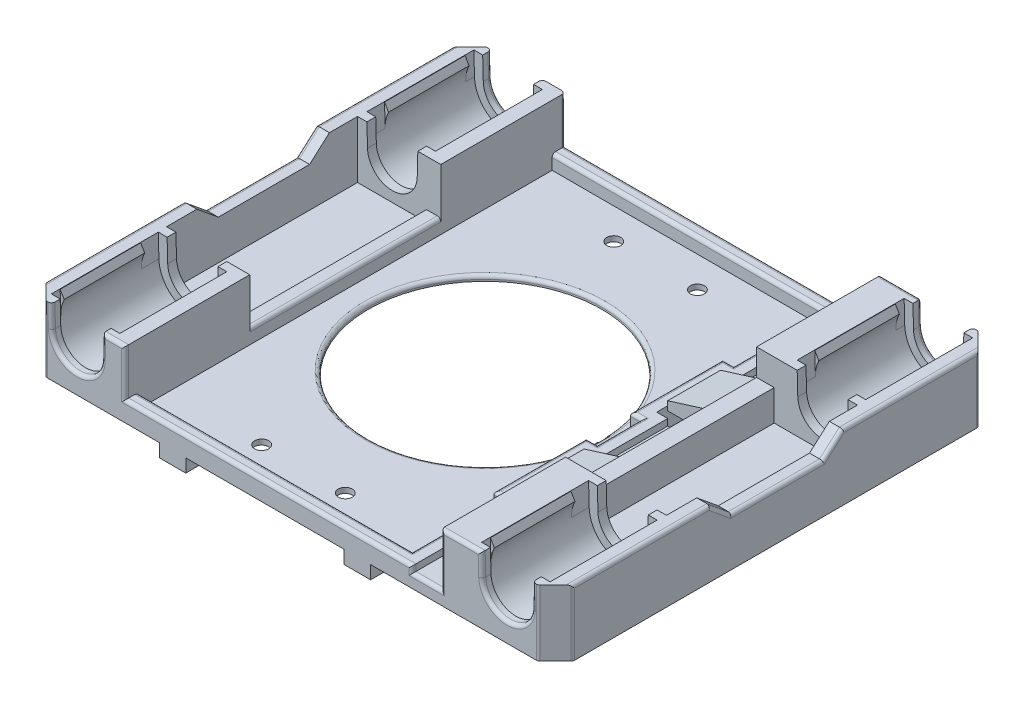
from build123d import *

# Parameters (mm, degrees)
SKETCH1_W               = 124.76
SKETCH1_H               = 100
BOSS_EXTRUDE1_DEPTH     = 20
SKETCH2_R               = 7.65
CUT_EXTRUDE1_DEPTH      = 120.546076473
SKETCH4_W               = 96
SKETCH4_H               = 18
CUT_EXTRUDE2_DEPTH      = 21.26
SKETCH5_W               = 96
SKETCH5_H               = 18
CUT_EXTRUDE3_DEPTH      = 24.5
SKETCH6_W               = 22
SKETCH6_H               = 18
SKETCH6_R               = 7.65
BOSS_EXTRUDE2_DEPTH     = 24.3
MIRROR2_COPY_1_SKETCH_W = 22
MIRROR2_COPY_1_SKETCH_H = 18
MIRROR2_COPY_1_SKETCH_R = 7.65
MIRROR2_COPY_1_DEPTH    = 24.3
CUT_EXTRUDE4_DEPTH      = 4
MIRROR4_COPY_1_DEPTH    = 4
CUT_EXTRUDE5_DEPTH      = 4
MIRROR6_COPY_1_DEPTH    = 4
CUT_EXTRUDE6_DEPTH      = 117.220757182
BOSS_EXTRUDE3_DEPTH     = 2
MIRROR11_COPY_1_DEPTH   = 2
BOSS_EXTRUDE4_DEPTH     = 2
MIRROR13_COPY_1_DEPTH   = 2
SKETCH14_W              = 2.5
SKETCH14_H              = 100
CUT_EXTRUDE9_DEPTH      = 83.421833499
SKETCH15_W              = 6.5
SKETCH15_H              = 100
CUT_EXTRUDE10_DEPTH     = 17
SKETCH16_W              = 3.08585698
SKETCH16_H              = 43.4
BOSS_EXTRUDE6_DEPTH     = 18
CUT_EXTRUDE11_DEPTH     = 16
SKETCH18_W              = 9
SKETCH18_H              = 15
CUT_EXTRUDE12_DEPTH     = 25
SKETCH19_W              = 12
SKETCH19_H              = 2
BOSS_EXTRUDE7_DEPTH     = 8
SKETCH21_R              = 26.5
CUT_EXTRUDE13_DEPTH     = 81.533312362
SKETCH23_W              = 119.76
SKETCH23_H              = 5.5
CUT_EXTRUDE18_DEPTH     = 119.269643769
SKETCH26_W              = 65.265
SKETCH26_H              = 100
CUT_EXTRUDE19_DEPTH     = 6.02
SKETCH27_W              = 43.4
SKETCH27_H              = 6.02
CUT_EXTRUDE20_DEPTH     = 6
SKETCH28_W              = 43.4
SKETCH28_H              = 6.02
CUT_EXTRUDE21_DEPTH     = 6
CUT_EXTRUDE25_DEPTH     = 4.48
SKETCH29_R              = 26.5
CUT_EXTRUDE23_DEPTH     = 3.3
CUT_EXTRUDE24_DEPTH     = 80.439375627
MIRROR21_COPY_1_DEPTH   = 80.439375627
FILLET3_R               = 0.8
RIB1_REACH              = 113.371
SKETCH32_WALL_W         = 233.117026496
SKETCH32_WALL_H         = 12
BOSS_EXTRUDE8_DEPTH     = 8
LPATTERN1_COUNT         = 3
LPATTERN1_PITCH         = 2
LPATTERN1_COL_COUNT     = 3
LPATTERN1_COL_PITCH     = 2
MIRROR23_COPY_1_DEPTH   = 8
MIRROR23_COPY_2_DEPTH   = 8
MIRROR23_COPY_3_DEPTH   = 8
MIRROR23_COPY_4_DEPTH   = 8
SKETCH37_W              = 6
SKETCH37_H              = 6
BOSS_EXTRUDE9_DEPTH     = 3
SKETCH38_W              = 5
SKETCH38_H              = 15
SKETCH38_W_2            = 4.5
SKETCH38_H_2            = 21
BOSS_EXTRUDE10_DEPTH    = 3
CUT_EXTRUDE26_REACH     = 81.439
SKETCH39_R              = 1.6


with BuildPart() as part:
    # Sketch1 → Boss-Extrude1 (new body)
    with BuildSketch(Plane(origin=(0, 0, 0), x_dir=(1, 0, 0), z_dir=(0, 1, 0))):
        Rectangle(SKETCH1_W, SKETCH1_H)
    extrude(amount=BOSS_EXTRUDE1_DEPTH)

    # Sketch2 → Cut-Extrude1 (cut, through all)
    with BuildSketch(Plane.XY.offset(50)):
        with Locations((-48.88, 10)):
            Circle(SKETCH2_R)
        with Locations((48.88, 10)):
            Circle(SKETCH2_R)
    extrude(amount=-CUT_EXTRUDE1_DEPTH, mode=Mode.SUBTRACT)

    # Sketch4 → Cut-Extrude2 (cut)
    with BuildSketch(Plane.ZY.offset(62.38)):
        with Locations((0, 11)):
            Rectangle(SKETCH4_W, SKETCH4_H)
    extrude(amount=-CUT_EXTRUDE2_DEPTH, mode=Mode.SUBTRACT)

    # Sketch5 → Cut-Extrude3 (cut)
    with BuildSketch(Plane(origin=(62.38, 0, 0), x_dir=(0, 0, -1), z_dir=(1, 0, 0))):
        with Locations((0, 11)):
            Rectangle(SKETCH5_W, SKETCH5_H)
    extrude(amount=-CUT_EXTRUDE3_DEPTH, mode=Mode.SUBTRACT)

    # Sketch6 → Boss-Extrude2 (add)
    with BuildSketch(Plane(origin=(0, 0, 48), x_dir=(-1, 0, 0), z_dir=(0, 0, -1))):
        with Locations((48.88, 11)):
            Rectangle(SKETCH6_W, SKETCH6_H)
        with Locations(Location((48.88, 10, 0), (0, 0, 180))):
            Circle(SKETCH6_R, mode=Mode.SUBTRACT)
    boss_extrude2 = extrude(amount=BOSS_EXTRUDE2_DEPTH)

    # Mirror1: Boss-Extrude2 across plane
    add(boss_extrude2.mirror(Plane.XY))

    # Mirror2: Boss-Extrude2 across plane
    add(boss_extrude2.mirror(Plane(origin=(0, 0, 0), x_dir=(0, 0, 1), z_dir=(1, 0, 0))))

    # Mirror2 copy 1 sketch → Mirror2 copy 1 (add)
    with BuildSketch(Plane.XY.offset(-48)):
        with Locations((48.88, 11)):
            Rectangle(MIRROR2_COPY_1_SKETCH_W, MIRROR2_COPY_1_SKETCH_H)
        with Locations(Location((48.88, 10, 0), (0, 0, 180))):
            Circle(MIRROR2_COPY_1_SKETCH_R, mode=Mode.SUBTRACT)
    extrude(amount=MIRROR2_COPY_1_DEPTH)

    # Sketch7 → Cut-Extrude4 (cut)
    with BuildSketch(Plane.XY.offset(50)):
        with BuildLine():
            Line((41.232614826, 9.8), (40.96585698, 20))
            Line((40.96585698, 20), (56.79414302, 20))
            Line((56.79414302, 20), (56.527385174, 9.8))
            ThreePointArc((56.527385174, 9.8), (48.88, 2.35), (41.232614826, 9.8))
        make_face()
    cut_extrude4 = extrude(amount=-CUT_EXTRUDE4_DEPTH, mode=Mode.SUBTRACT)

    # Mirror3: Cut-Extrude4 across plane
    add(cut_extrude4.mirror(Plane(origin=(0, 0, 0), x_dir=(0, 0, 1), z_dir=(1, 0, 0))), mode=Mode.SUBTRACT)

    # Mirror4: Cut-Extrude4 across plane
    add(cut_extrude4.mirror(Plane.XY), mode=Mode.SUBTRACT)

    # Mirror4 copy 1 sketch → Mirror4 copy 1 (cut)
    with BuildSketch(Plane(origin=(0, 0, -50), x_dir=(-1, 0, 0), z_dir=(0, 0, -1))):
        with BuildLine():
            Line((41.232614826, 9.8), (40.96585698, 20))
            Line((40.96585698, 20), (56.79414302, 20))
            Line((56.79414302, 20), (56.527385174, 9.8))
            ThreePointArc((56.527385174, 9.8), (48.88, 2.35), (41.232614826, 9.8))
        make_face()
    extrude(amount=-MIRROR4_COPY_1_DEPTH, mode=Mode.SUBTRACT)

    # Sketch8 → Cut-Extrude5 (cut)
    with BuildSketch(Plane.XY.offset(-23.7)):
        with BuildLine():
            Line((56.527385174, 9.8), (56.79414302, 20))
            Line((56.79414302, 20), (40.96585698, 20))
            Line((40.96585698, 20), (41.232614826, 9.8))
            ThreePointArc((41.232614826, 9.8), (48.88, 2.35), (56.527385174, 9.8))
        make_face()
    cut_extrude5 = extrude(amount=-CUT_EXTRUDE5_DEPTH, mode=Mode.SUBTRACT)

    # Mirror5: Cut-Extrude5 across plane
    add(cut_extrude5.mirror(Plane(origin=(0, 0, 0), x_dir=(0, 0, 1), z_dir=(1, 0, 0))), mode=Mode.SUBTRACT)

    # Mirror6: Cut-Extrude5 across plane
    add(cut_extrude5.mirror(Plane.XY), mode=Mode.SUBTRACT)

    # Mirror6 copy 1 sketch → Mirror6 copy 1 (cut)
    with BuildSketch(Plane(origin=(0, 0, 23.7), x_dir=(-1, 0, 0), z_dir=(0, 0, -1))):
        with BuildLine():
            Line((56.527385174, 9.8), (56.79414302, 20))
            Line((56.79414302, 20), (40.96585698, 20))
            Line((40.96585698, 20), (41.232614826, 9.8))
            ThreePointArc((41.232614826, 9.8), (48.88, 2.35), (56.527385174, 9.8))
        make_face()
    extrude(amount=-MIRROR6_COPY_1_DEPTH, mode=Mode.SUBTRACT)

    # Sketch10 → Cut-Extrude6 (cut, symmetric)
    with BuildSketch(Plane(origin=(0, 0, -46), x_dir=(-1, 0, 0), z_dir=(0, 0, -1))):
        with BuildLine():
            Line((41.09916923, 14.902549345), (41.999314668, 13.343451713))
            ThreePointArc((41.999314668, 13.343451713), (48.88, 17.65), (55.760685332, 13.343451713))
            Line((55.760685332, 13.343451713), (56.66083077, 14.902549345))
            Line((56.66083077, 14.902549345), (56.79414302, 20))
            Line((56.79414302, 20), (40.96585698, 20))
            Line((40.96585698, 20), (41.09916923, 14.902549345))
        make_face()
    cut_extrude6 = extrude(amount=CUT_EXTRUDE6_DEPTH, both=True, mode=Mode.SUBTRACT)

    # Mirror7: Cut-Extrude6 across plane
    add(cut_extrude6.mirror(Plane(origin=(0, 0, 0), x_dir=(0, 0, 1), z_dir=(1, 0, 0))), mode=Mode.SUBTRACT)

    # Sketch12 → Boss-Extrude3 (add)
    with BuildSketch(Plane(origin=(0, 0, -50), x_dir=(-1, 0, 0), z_dir=(0, 0, -1))):
        with BuildLine():
            Line((54.794826635, 20.052287582), (62.38, 20))
            Line((62.38, 20), (62.38, 0))
            Line((62.38, 0), (30.802582176, 0))
            Line((30.802582176, 0), (30.802582176, 20))
            Line((30.802582176, 20), (42.965173365, 20.052287582))
            Line((42.965173365, 20.052287582), (43.231931211, 9.852287582))
            ThreePointArc((43.231931211, 9.852287582), (48.88, 4.35), (54.528068789, 9.852287582))
            Line((54.528068789, 9.852287582), (54.794826635, 20.052287582))
        make_face()
    boss_extrude3 = extrude(amount=-BOSS_EXTRUDE3_DEPTH)

    # Mirror10: Boss-Extrude3 across plane
    add(boss_extrude3.mirror(Plane(origin=(0, 0, 0), x_dir=(0, 0, 1), z_dir=(1, 0, 0))))

    # Mirror11: Boss-Extrude3 across plane
    add(boss_extrude3.mirror(Plane.XY))

    # Mirror11 copy 1 sketch → Mirror11 copy 1 (add)
    with BuildSketch(Plane.XY.offset(50)):
        with BuildLine():
            Line((54.794826635, 20.052287582), (62.38, 20))
            Line((62.38, 20), (62.38, 0))
            Line((62.38, 0), (30.802582176, 0))
            Line((30.802582176, 0), (30.802582176, 20))
            Line((30.802582176, 20), (42.965173365, 20.052287582))
            Line((42.965173365, 20.052287582), (43.231931211, 9.852287582))
            ThreePointArc((43.231931211, 9.852287582), (48.88, 4.35), (54.528068789, 9.852287582))
            Line((54.528068789, 9.852287582), (54.794826635, 20.052287582))
        make_face()
    extrude(amount=-MIRROR11_COPY_1_DEPTH)

    # Sketch13 → Boss-Extrude4 (add)
    with BuildSketch(Plane(origin=(0, 0, 23.7), x_dir=(-1, 0, 0), z_dir=(0, 0, -1))):
        with BuildLine():
            Line((54.794826635, 20.052287582), (54.528068789, 9.852287582))
            ThreePointArc((54.528068789, 9.852287582), (48.88, 4.35), (43.231931211, 9.852287582))
            Line((43.231931211, 9.852287582), (42.965173365, 20.052287582))
            Line((42.965173365, 20.052287582), (35.5, 20))
            Line((35.5, 20), (35.5, 2))
            Line((35.5, 2), (59.88, 2))
            Line((59.88, 2), (59.88, 20))
            Line((59.88, 20), (56.79414302, 20))
            Line((56.79414302, 20), (54.794826635, 20.052287582))
        make_face()
    boss_extrude4 = extrude(amount=BOSS_EXTRUDE4_DEPTH)

    # Mirror12: Boss-Extrude4 across plane
    add(boss_extrude4.mirror(Plane(origin=(0, 0, 0), x_dir=(0, 0, 1), z_dir=(1, 0, 0))))

    # Mirror13: Boss-Extrude4 across plane
    add(boss_extrude4.mirror(Plane.XY))

    # Mirror13 copy 1 sketch → Mirror13 copy 1 (add)
    with BuildSketch(Plane.XY.offset(-23.7)):
        with BuildLine():
            Line((54.794826635, 20.052287582), (54.528068789, 9.852287582))
            ThreePointArc((54.528068789, 9.852287582), (48.88, 4.35), (43.231931211, 9.852287582))
            Line((43.231931211, 9.852287582), (42.965173365, 20.052287582))
            Line((42.965173365, 20.052287582), (35.5, 20))
            Line((35.5, 20), (35.5, 2))
            Line((35.5, 2), (59.88, 2))
            Line((59.88, 2), (59.88, 20))
            Line((59.88, 20), (56.79414302, 20))
            Line((56.79414302, 20), (54.794826635, 20.052287582))
        make_face()
    extrude(amount=MIRROR13_COPY_1_DEPTH)

    # Sketch14 → Cut-Extrude9 (cut, through all)
    with BuildSketch(Plane.XZ):
        with Locations((61.13, 0)):
            Rectangle(SKETCH14_W, SKETCH14_H)
    cut_extrude9 = extrude(amount=-CUT_EXTRUDE9_DEPTH, mode=Mode.SUBTRACT)

    # Mirror15: Cut-Extrude9 across plane
    add(cut_extrude9.mirror(Plane(origin=(0, 0, 0), x_dir=(0, 0, 1), z_dir=(1, 0, 0))), mode=Mode.SUBTRACT)

    # Sketch15 → Cut-Extrude10 (cut)
    with BuildSketch(Plane(origin=(0, 20, 0), x_dir=(1, 0, 0), z_dir=(0, 1, 0))):
        with Locations((30.63, 0)):
            Rectangle(SKETCH15_W, SKETCH15_H)
    extrude(amount=-CUT_EXTRUDE10_DEPTH, mode=Mode.SUBTRACT)

    # Sketch16 → Boss-Extrude6 (add)
    with BuildSketch(Plane(origin=(0, 2, 0), x_dir=(1, 0, 0), z_dir=(0, 1, 0))):
        with Locations((-58.33707151, 0)):
            Rectangle(SKETCH16_W, SKETCH16_H)
    boss_extrude6 = extrude(amount=BOSS_EXTRUDE6_DEPTH)

    # Mirror16: Boss-Extrude6 across plane
    add(boss_extrude6.mirror(Plane(origin=(0, 0, 0), x_dir=(0, 0, 1), z_dir=(1, 0, 0))))

    # Sketch17 → Cut-Extrude11 (cut)
    with BuildSketch(Plane(origin=(59.88, 0, 0), x_dir=(0, 0, -1), z_dir=(1, 0, 0))):
        Polygon((20.943323178, 20), (10.8, 11), (-9.939894563, 11), (-20.900937415, 20), align=None)
    cut_extrude11 = extrude(amount=-CUT_EXTRUDE11_DEPTH, mode=Mode.SUBTRACT)

    # Mirror17: Cut-Extrude11 across plane
    add(cut_extrude11.mirror(Plane(origin=(0, 0, 0), x_dir=(0, 0, 1), z_dir=(1, 0, 0))), mode=Mode.SUBTRACT)

    # Sketch18 → Cut-Extrude12 (cut)
    with BuildSketch(Plane.XZ):
        with Locations((29.38, 15.5)):
            Rectangle(SKETCH18_W, SKETCH18_H)
    cut_extrude12 = extrude(amount=-CUT_EXTRUDE12_DEPTH, mode=Mode.SUBTRACT)

    # Mirror18: Cut-Extrude12 across plane
    add(cut_extrude12.mirror(Plane.XY), mode=Mode.SUBTRACT)

    # Sketch19 → Boss-Extrude7 (add)
    with BuildSketch(Plane.ZY.offset(-33.88)):
        with Locations((-15.5, 5.5)):
            Rectangle(SKETCH19_W, SKETCH19_H)
    boss_extrude7 = extrude(amount=BOSS_EXTRUDE7_DEPTH)

    # Mirror19: Boss-Extrude7 across plane
    add(boss_extrude7.mirror(Plane.XY))

    # Sketch21 → Cut-Extrude13 (cut, through all)
    with BuildSketch(Plane(origin=(0, 20, 0), x_dir=(1, 0, 0), z_dir=(0, 1, 0))):
        with Locations(Location((-6.12, 0, 0), (0, 0, 270))):
            Circle(SKETCH21_R)
    extrude(amount=-CUT_EXTRUDE13_DEPTH, mode=Mode.SUBTRACT)

    # Sketch23 → Cut-Extrude18 (cut, through all)
    with BuildSketch(Plane.XY.offset(50)):
        with Locations((0, 17.75)):
            Rectangle(SKETCH23_W, SKETCH23_H)
    extrude(amount=-CUT_EXTRUDE18_DEPTH, mode=Mode.SUBTRACT)

    # Sketch26 → Cut-Extrude19 (cut)
    with BuildSketch(Plane(origin=(0, 15, 0), x_dir=(1, 0, 0), z_dir=(0, 1, 0))):
        with Locations((-5.2525, 0)):
            Rectangle(SKETCH26_W, SKETCH26_H)
    extrude(amount=-CUT_EXTRUDE19_DEPTH, mode=Mode.SUBTRACT)

    # Sketch27 → Cut-Extrude20 (cut)
    with BuildSketch(Plane(origin=(-37.885, 0, 0), x_dir=(0, 0, -1), z_dir=(1, 0, 0))):
        with Locations((0, 11.99)):
            Rectangle(SKETCH27_W, SKETCH27_H)
    extrude(amount=-CUT_EXTRUDE20_DEPTH, mode=Mode.SUBTRACT)

    # Sketch28 → Cut-Extrude21 (cut)
    with BuildSketch(Plane(origin=(37.88, 0, 0), x_dir=(0, 0, -1), z_dir=(1, 0, 0))):
        with Locations((0, 11.99)):
            Rectangle(SKETCH28_W, SKETCH28_H)
    extrude(amount=-CUT_EXTRUDE21_DEPTH, mode=Mode.SUBTRACT)

    # Sketch31 → Cut-Extrude25 (cut)
    with BuildSketch(Plane(origin=(0, 8.98, 0), x_dir=(1, 0, 0), z_dir=(0, 1, 0))):
        Polygon((27.38, 23), (27.38, 50), (-37.885, 50), (-37.885, 21.7), (-41.12, 21.7), (-41.12, -21.7), (-37.885, -21.7), (-37.885, -50), (27.38, -50), (27.38, -23), (24.88, -23), (24.88, -8), (27.38, -8), (27.38, 8), (24.88, 8), (24.88, 23), align=None)
    extrude(amount=-CUT_EXTRUDE25_DEPTH, mode=Mode.SUBTRACT)

    # Sketch29 → Cut-Extrude23 (cut)
    with BuildSketch(Plane(origin=(0, 4.5, 0), x_dir=(1, 0, 0), z_dir=(0, 1, 0))):
        Polygon((-37.885, 47), (-37.885, -47), (24.38, -47), (24.38, -26), (21.88, -26), (21.88, -5), (24.38, -5), (24.38, 5), (21.88, 5), (21.88, 26), (24.38, 26), (24.38, 47), align=None)
        with Locations(Location((-6.12, 0, 0), (0, 0, 270))):
            Circle(SKETCH29_R, mode=Mode.SUBTRACT)
    extrude(amount=-CUT_EXTRUDE23_DEPTH, mode=Mode.SUBTRACT)

    # Sketch30 → Cut-Extrude24 (cut, through all)
    with BuildSketch(Plane.XZ):
        Polygon((-55.88, 50), (-59.88, 46), (-59.88, 50), align=None)
    cut_extrude24 = extrude(amount=-CUT_EXTRUDE24_DEPTH, mode=Mode.SUBTRACT)

    # Mirror20: Cut-Extrude24 across plane
    add(cut_extrude24.mirror(Plane.XY), mode=Mode.SUBTRACT)

    # Mirror21: Cut-Extrude24 across plane
    add(cut_extrude24.mirror(Plane(origin=(0, 0, 0), x_dir=(0, 0, 1), z_dir=(1, 0, 0))), mode=Mode.SUBTRACT)

    # Mirror21 copy 1 sketch → Mirror21 copy 1 (cut, through all)
    with BuildSketch(Plane(origin=(0, 0, 0), x_dir=(-1, 0, 0), z_dir=(0, -1, 0))):
        Polygon((-55.88, 50), (-59.88, 46), (-59.88, 50), align=None)
    extrude(amount=-MIRROR21_COPY_1_DEPTH, mode=Mode.SUBTRACT)

    # Fillet3
    fillet3_edges = [part.edges().sort_by_distance(p)[0] for p in [
        (38.488652239, 15, 50),
        (-37.885, 9.75, 50),
        (-37.885, 9.75, -50),
        (-5.2525, 4.5, 50),
        (-5.2525, 4.5, -50),
        (-37.885, 4.5, 0),
        (-6.12, 1.2, -26.5),
        (-6.7525, 4.5, -47),
        (-6.7525, 4.5, 47),
        (24.38, 4.5, 36.5),
        (23.13, 4.5, 26),
        (21.88, 4.5, 15.5),
        (23.13, 4.5, 5),
        (24.38, 4.5, 0),
        (23.13, 4.5, -5),
        (21.88, 4.5, -15.5),
        (23.13, 4.5, -26),
        (24.38, 4.5, -36.5),
        (-55.88, 7.5, 50),
        (-59.88, 7.5, 46),
        (-59.88, 15, -30.654071817),
        (-55.88, 7.5, -50),
        (-59.88, 7.5, -46),
        (55.88, 7.5, 50),
        (59.88, 7.5, 46),
        (59.88, 15, -30.654071817),
        (55.88, 7.5, -50),
        (59.88, 7.5, -46),
        (-48.88, 4.35, -50),
        (-43.164617845, 12.426143791, -50),
        (48.88, 4.35, -50),
        (43.164617845, 12.426143791, -50),
        (-48.88, 4.35, 50),
        (-43.164617845, 12.426143791, 50),
        (48.88, 4.35, 50),
        (43.164617845, 12.426143791, 50),
        (30.63, 3, 50),
        (33.88, 9, 50),
        (27.38, 3.75, 50),
        (30.63, 3, -50),
        (27.38, 3.75, -50),
        (33.88, 9, -50),
        (59.88, 11, -0.430052718),
        (59.88, 13, -13.054071817),
        (-59.88, 11, -0.430052718),
        (-59.88, 13, -13.054071817),
        (-59.88, 13, 12.375681864),
        (59.88, 13, 12.375681864),
        (54.595382155, 12.426143791, 50),
        (-54.595382155, 12.426143791, 50),
        (54.595382155, 12.426143791, -50),
        (-54.595382155, 12.426143791, -50),
        (-40.491152239, 15, 50),
        (-59.88, 15, 30.405734582),
        (38.488652239, 15, -50),
        (59.88, 15, 30.405734582),
    ]]
    fillet(fillet3_edges, radius=FILLET3_R)

    # Sketch32 wall → Rib1 (add, up to next)
    with BuildSketch(Plane(origin=(29.88, 7.74, 9.5), x_dir=(0.955157326174, 0.296098771114, 0), z_dir=(-0.296098771114, 0.955157326174, 0)), mode=Mode.PRIVATE) as rib1_sk1:
        with Locations((0, -6)):
            Rectangle(SKETCH32_WALL_W, SKETCH32_WALL_H)
    rib1_tool1 = extrude(rib1_sk1.sketch, amount=-RIB1_REACH, mode=Mode.PRIVATE) - part.part
    rib1 = rib1_tool1.solids().sort_by_distance((29.88, 7.74, 9.5))[0]
    add(rib1)

    # Mirror22: Rib1 across plane
    add(rib1.mirror(Plane.XY))

    # Sketch36 → Boss-Extrude8 (add)
    with BuildSketch(Plane.ZY.offset(-33.88)):
        with BuildLine():
            Line((15.054208339, 4.14), (14.925, 4.5))
            Line((14.925, 4.5), (16.075, 4.5))
            Line((16.075, 4.5), (15.945791661, 4.14))
            ThreePointArc((15.945791661, 4.14), (15.5, 3.826364903), (15.054208339, 4.14))
        make_face()
    boss_extrude8 = extrude(amount=BOSS_EXTRUDE8_DEPTH)

    # LPattern1: Boss-Extrude8 ×3
    with Locations(*[(0, 0, i * LPATTERN1_PITCH) for i in range(1, LPATTERN1_COUNT)]):
        add(boss_extrude8)

    # LPattern1 col: Boss-Extrude8 ×3
    with Locations(*[(0, 0, -i * LPATTERN1_COL_PITCH) for i in range(1, LPATTERN1_COL_COUNT)]):
        add(boss_extrude8)

    # Mirror23: Boss-Extrude8 across plane
    add(boss_extrude8.mirror(Plane.XY))

    # Mirror23 copy 1 sketch → Mirror23 copy 1 (add)
    with BuildSketch(Plane(origin=(33.88, 0, -2), x_dir=(0, 0, -1), z_dir=(-1, 0, 0))):
        with BuildLine():
            Line((15.054208339, -4.14), (14.925, -4.5))
            Line((14.925, -4.5), (16.075, -4.5))
            Line((16.075, -4.5), (15.945791661, -4.14))
            ThreePointArc((15.945791661, -4.14), (15.5, -3.826364903), (15.054208339, -4.14))
        make_face()
    extrude(amount=MIRROR23_COPY_1_DEPTH)

    # Mirror23 copy 2 sketch → Mirror23 copy 2 (add)
    with BuildSketch(Plane(origin=(33.88, 0, -4), x_dir=(0, 0, -1), z_dir=(-1, 0, 0))):
        with BuildLine():
            Line((15.054208339, -4.14), (14.925, -4.5))
            Line((14.925, -4.5), (16.075, -4.5))
            Line((16.075, -4.5), (15.945791661, -4.14))
            ThreePointArc((15.945791661, -4.14), (15.5, -3.826364903), (15.054208339, -4.14))
        make_face()
    extrude(amount=MIRROR23_COPY_2_DEPTH)

    # Mirror23 copy 3 sketch → Mirror23 copy 3 (add)
    with BuildSketch(Plane(origin=(33.88, 0, 2), x_dir=(0, 0, -1), z_dir=(-1, 0, 0))):
        with BuildLine():
            Line((15.054208339, -4.14), (14.925, -4.5))
            Line((14.925, -4.5), (16.075, -4.5))
            Line((16.075, -4.5), (15.945791661, -4.14))
            ThreePointArc((15.945791661, -4.14), (15.5, -3.826364903), (15.054208339, -4.14))
        make_face()
    extrude(amount=MIRROR23_COPY_3_DEPTH)

    # Mirror23 copy 4 sketch → Mirror23 copy 4 (add)
    with BuildSketch(Plane(origin=(33.88, 0, 4), x_dir=(0, 0, -1), z_dir=(-1, 0, 0))):
        with BuildLine():
            Line((15.054208339, -4.14), (14.925, -4.5))
            Line((14.925, -4.5), (16.075, -4.5))
            Line((16.075, -4.5), (15.945791661, -4.14))
            ThreePointArc((15.945791661, -4.14), (15.5, -3.826364903), (15.054208339, -4.14))
        make_face()
    extrude(amount=MIRROR23_COPY_4_DEPTH)

    # Sketch37 → Boss-Extrude9 (add)
    with BuildSketch(Plane.XZ):
        with Locations((14.88, 47)):
            Rectangle(SKETCH37_W, SKETCH37_H)
        with Locations((-27.12, 47)):
            Rectangle(SKETCH37_W, SKETCH37_H)
        with Locations((14.88, -47)):
            Rectangle(SKETCH37_W, SKETCH37_H)
        with Locations((-27.12, -47)):
            Rectangle(SKETCH37_W, SKETCH37_H)
    extrude(amount=BOSS_EXTRUDE9_DEPTH)

    # Sketch38 → Boss-Extrude10 (add)
    with BuildSketch(Plane.XZ):
        with Locations((45.93, 12.5)):
            Rectangle(SKETCH38_W, SKETCH38_H)
        with Locations((-46.99, 0)):
            Rectangle(SKETCH38_W_2, SKETCH38_H_2)
    extrude(amount=BOSS_EXTRUDE10_DEPTH)

    # Sketch39 → Cut-Extrude26 (cut, up to next)
    with BuildSketch(Plane.XZ, mode=Mode.PRIVATE) as cut_extrude26_sk1:
        with Locations(Location((2.12, 40, 0), (0, 0, 270))):
            Circle(SKETCH39_R)
    cut_extrude26_tool1 = extrude(cut_extrude26_sk1.sketch, amount=-CUT_EXTRUDE26_REACH, mode=Mode.PRIVATE) & part.part
    # Sketch39 → Cut-Extrude26 (cut, up to next)
    with BuildSketch(Plane.XZ, mode=Mode.PRIVATE) as cut_extrude26_sk2:
        with Locations(Location((-16.88, 40, 0), (0, 0, 270))):
            Circle(SKETCH39_R)
    cut_extrude26_tool2 = extrude(cut_extrude26_sk2.sketch, amount=-CUT_EXTRUDE26_REACH, mode=Mode.PRIVATE) & part.part
    # Sketch39 → Cut-Extrude26 (cut, up to next)
    with BuildSketch(Plane.XZ, mode=Mode.PRIVATE) as cut_extrude26_sk3:
        with Locations(Location((2.12, -40, 0), (0, 0, 270))):
            Circle(SKETCH39_R)
    cut_extrude26_tool3 = extrude(cut_extrude26_sk3.sketch, amount=-CUT_EXTRUDE26_REACH, mode=Mode.PRIVATE) & part.part
    # Sketch39 → Cut-Extrude26 (cut, up to next)
    with BuildSketch(Plane.XZ, mode=Mode.PRIVATE) as cut_extrude26_sk4:
        with Locations(Location((-16.88, -40, 0), (0, 0, 270))):
            Circle(SKETCH39_R)
    cut_extrude26_tool4 = extrude(cut_extrude26_sk4.sketch, amount=-CUT_EXTRUDE26_REACH, mode=Mode.PRIVATE) & part.part
    add(cut_extrude26_tool1.solids().sort_by_distance((2.12, 0, 40))[0], mode=Mode.SUBTRACT)
    add(cut_extrude26_tool2.solids().sort_by_distance((-16.88, 0, 40))[0], mode=Mode.SUBTRACT)
    add(cut_extrude26_tool3.solids().sort_by_distance((2.12, 0, -40))[0], mode=Mode.SUBTRACT)
    add(cut_extrude26_tool4.solids().sort_by_distance((-16.88, 0, -40))[0], mode=Mode.SUBTRACT)


solid = part.part
